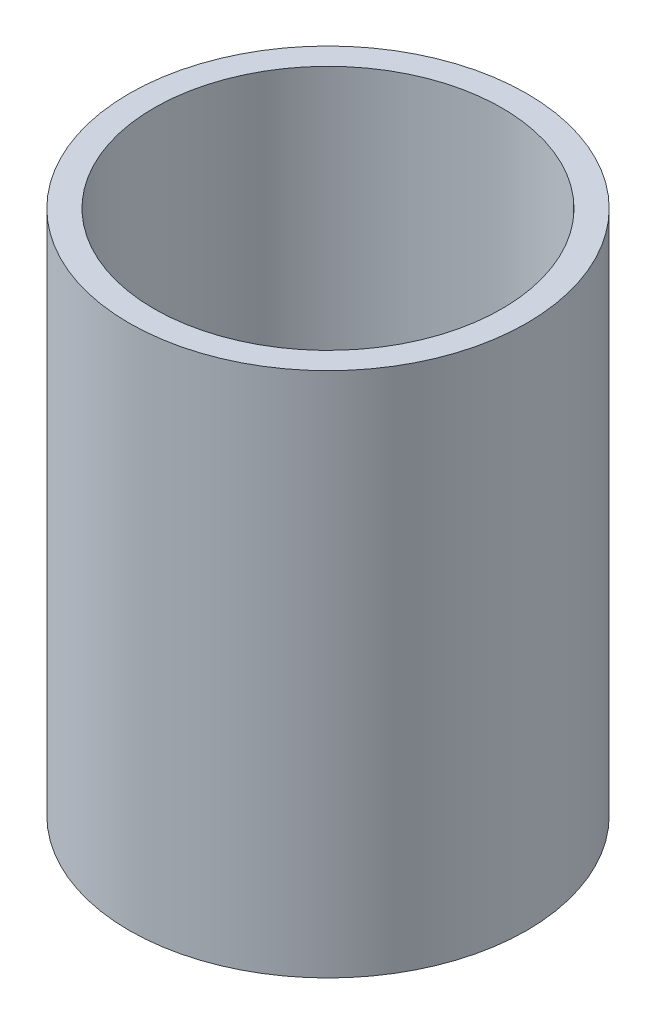
from build123d import *

# Parameters (mm, degrees)
SKETCH1_R           = 30
BOSS_EXTRUDE1_DEPTH = 79.353391609
SKETCH2_R           = 26.249650083
CUT_EXTRUDE1_DEPTH  = 90.983113748


with BuildPart() as part:
    # Sketch1 → Boss-Extrude1 (new body)
    with BuildSketch(Plane(origin=(0, 0, 0), x_dir=(1, 0, 0), z_dir=(0, 1, 0))):
        Circle(SKETCH1_R)
    extrude(amount=BOSS_EXTRUDE1_DEPTH)

    # Sketch2 → Cut-Extrude1 (cut, through all)
    with BuildSketch(Plane(origin=(0, 0, 0), x_dir=(1, 0, 0), z_dir=(0, 1, 0))):
        Circle(SKETCH2_R)
    extrude(amount=CUT_EXTRUDE1_DEPTH, mode=Mode.SUBTRACT)


solid = part.part
